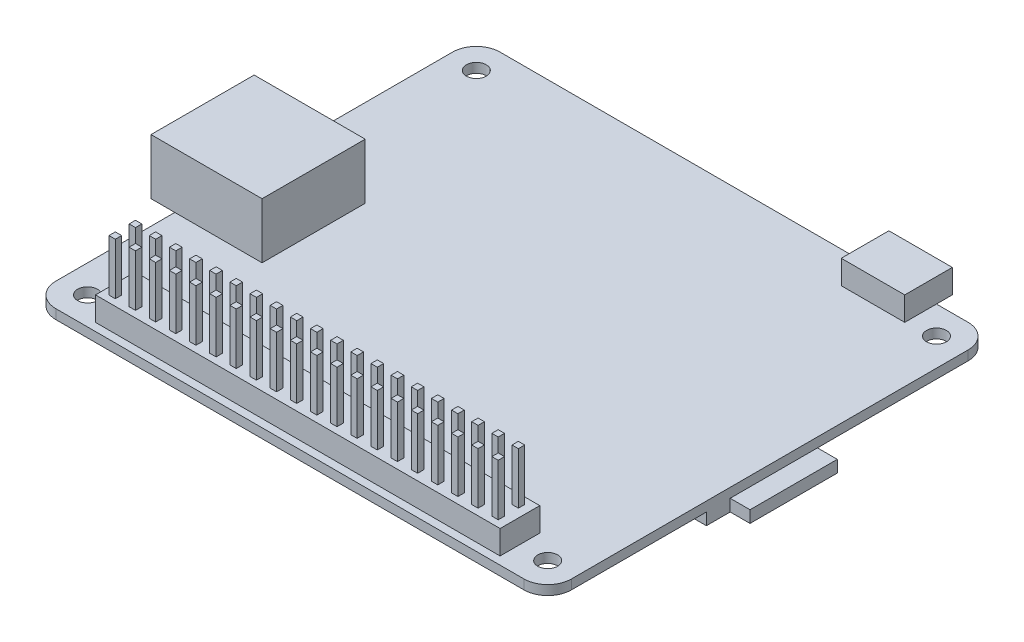
from build123d import *

# Parameters (mm, degrees)
SKETCH1_W             = 65
SKETCH1_H             = 56
BOSS_EXTRUDE1_DEPTH   = 1.2
FILLET1_R             = 3
SKETCH2_R             = 1.25
CUT_EXTRUDE1_DEPTH    = 43.914915822
SKETCH3_W             = 14
SKETCH3_H             = 13
BOSS_EXTRUDE2_DEPTH   = 7
SKETCH4_W             = 51
SKETCH4_H             = 5
BOSS_EXTRUDE3_DEPTH   = 3
SKETCH5_W             = 0.8
SKETCH5_H             = 0.8
BOSS_EXTRUDE4_DEPTH   = 6.5
LPATTERN1_START       = 25.37
LPATTERN1_OUTLINE_W   = 0.8
LPATTERN1_OUTLINE_H   = 6.5
LPATTERN1_DEPTH       = 0.8
LPATTERN1_START_2     = 22.83
LPATTERN1_2_OUTLINE_W = 0.8
LPATTERN1_2_OUTLINE_H = 6.5
LPATTERN1_2_DEPTH     = 0.8
SKETCH7_W             = 18
SKETCH7_H             = 14
BOSS_EXTRUDE5_DEPTH   = 1.5
SKETCH8_W             = 10.030168032
SKETCH8_H             = 8.209032263
CUT_EXTRUDE2_DEPTH    = 1.5
SKETCH9_W             = 8
SKETCH9_H             = 6
BOSS_EXTRUDE6_DEPTH   = 3


# Read off the part's stored shape, not the designer's step: LPattern1
with BuildPart() as part:
    # Sketch1 → Boss-Extrude1 (new body)
    with BuildSketch(Plane(origin=(0, 0, 0), x_dir=(1, 0, 0), z_dir=(0, 1, 0))):
        Rectangle(SKETCH1_W, SKETCH1_H)
    extrude(amount=BOSS_EXTRUDE1_DEPTH)

    # Fillet1
    fillet1_edges = [part.edges().sort_by_distance(p)[0] for p in [
        (32.5, 0.6, 28),
        (-32.5, 0.6, 28),
        (-32.5, 0.6, -28),
        (32.5, 0.6, -28),
    ]]
    fillet(fillet1_edges, radius=FILLET1_R)

    # Sketch2 → Cut-Extrude1 (cut, through all)
    with BuildSketch(Plane(origin=(0, 1.2, 0), x_dir=(1, 0, 0), z_dir=(0, 1, 0))):
        with Locations(Location((-29, 24.5, 0), (0, 0, 270))):
            Circle(SKETCH2_R)
        with Locations(Location((29, 24.5, 0), (0, 0, 270))):
            Circle(SKETCH2_R)
        with Locations(Location((29, -24.5, 0), (0, 0, 270))):
            Circle(SKETCH2_R)
        with Locations(Location((-29, -24.5, 0), (0, 0, 270))):
            Circle(SKETCH2_R)
    extrude(amount=-CUT_EXTRUDE1_DEPTH, mode=Mode.SUBTRACT)

    # Sketch3 → Boss-Extrude2 (add)
    with BuildSketch(Plane(origin=(0, 1.2, 0), x_dir=(1, 0, 0), z_dir=(0, 1, 0))):
        with Locations((-28.5, -3.5)):
            Rectangle(SKETCH3_W, SKETCH3_H)
    extrude(amount=BOSS_EXTRUDE2_DEPTH)

    # Sketch4 → Boss-Extrude3 (add)
    with BuildSketch(Plane(origin=(0, 1.2, 0), x_dir=(1, 0, 0), z_dir=(0, 1, 0))):
        with Locations((0, -24.5)):
            Rectangle(SKETCH4_W, SKETCH4_H)
    extrude(amount=BOSS_EXTRUDE3_DEPTH)

    # Sketch5 → Boss-Extrude4 (add)
    with BuildSketch(Plane(origin=(0, 4.2, 0), x_dir=(1, 0, 0), z_dir=(0, 1, 0))):
        with Locations((-24.227, -23.23)):
            Rectangle(SKETCH5_W, SKETCH5_H)
    extrude(amount=BOSS_EXTRUDE4_DEPTH)

    # LPattern1 outline → LPattern1 (add)
    with BuildSketch(Plane.XY.offset(LPATTERN1_START)):
        with Locations((24.033, 7.45)):
            Rectangle(LPATTERN1_OUTLINE_W, LPATTERN1_OUTLINE_H)
        with Locations((21.493, 7.45)):
            Rectangle(LPATTERN1_OUTLINE_W, LPATTERN1_OUTLINE_H)
        with Locations((18.953, 7.45)):
            Rectangle(LPATTERN1_OUTLINE_W, LPATTERN1_OUTLINE_H)
        with Locations((16.413, 7.45)):
            Rectangle(LPATTERN1_OUTLINE_W, LPATTERN1_OUTLINE_H)
        with Locations((13.873, 7.45)):
            Rectangle(LPATTERN1_OUTLINE_W, LPATTERN1_OUTLINE_H)
        with Locations((11.333, 7.45)):
            Rectangle(LPATTERN1_OUTLINE_W, LPATTERN1_OUTLINE_H)
        with Locations((8.793, 7.45)):
            Rectangle(LPATTERN1_OUTLINE_W, LPATTERN1_OUTLINE_H)
        with Locations((6.253, 7.45)):
            Rectangle(LPATTERN1_OUTLINE_W, LPATTERN1_OUTLINE_H)
        with Locations((3.713, 7.45)):
            Rectangle(LPATTERN1_OUTLINE_W, LPATTERN1_OUTLINE_H)
        with Locations((1.173, 7.45)):
            Rectangle(LPATTERN1_OUTLINE_W, LPATTERN1_OUTLINE_H)
        with Locations((-1.367, 7.45)):
            Rectangle(LPATTERN1_OUTLINE_W, LPATTERN1_OUTLINE_H)
        with Locations((-3.907, 7.45)):
            Rectangle(LPATTERN1_OUTLINE_W, LPATTERN1_OUTLINE_H)
        with Locations((-6.447, 7.45)):
            Rectangle(LPATTERN1_OUTLINE_W, LPATTERN1_OUTLINE_H)
        with Locations((-8.987, 7.45)):
            Rectangle(LPATTERN1_OUTLINE_W, LPATTERN1_OUTLINE_H)
        with Locations((-11.527, 7.45)):
            Rectangle(LPATTERN1_OUTLINE_W, LPATTERN1_OUTLINE_H)
        with Locations((-14.067, 7.45)):
            Rectangle(LPATTERN1_OUTLINE_W, LPATTERN1_OUTLINE_H)
        with Locations((-16.607, 7.45)):
            Rectangle(LPATTERN1_OUTLINE_W, LPATTERN1_OUTLINE_H)
        with Locations((-19.147, 7.45)):
            Rectangle(LPATTERN1_OUTLINE_W, LPATTERN1_OUTLINE_H)
        with Locations((-21.687, 7.45)):
            Rectangle(LPATTERN1_OUTLINE_W, LPATTERN1_OUTLINE_H)
        with Locations((-24.227, 7.45)):
            Rectangle(LPATTERN1_OUTLINE_W, LPATTERN1_OUTLINE_H)
    extrude(amount=LPATTERN1_DEPTH)

    # LPattern1 2 outline → LPattern1 2 (add)
    with BuildSketch(Plane.XY.offset(LPATTERN1_START_2)):
        with Locations((24.033, 7.45)):
            Rectangle(LPATTERN1_2_OUTLINE_W, LPATTERN1_2_OUTLINE_H)
        with Locations((21.493, 7.45)):
            Rectangle(LPATTERN1_2_OUTLINE_W, LPATTERN1_2_OUTLINE_H)
        with Locations((18.953, 7.45)):
            Rectangle(LPATTERN1_2_OUTLINE_W, LPATTERN1_2_OUTLINE_H)
        with Locations((16.413, 7.45)):
            Rectangle(LPATTERN1_2_OUTLINE_W, LPATTERN1_2_OUTLINE_H)
        with Locations((13.873, 7.45)):
            Rectangle(LPATTERN1_2_OUTLINE_W, LPATTERN1_2_OUTLINE_H)
        with Locations((11.333, 7.45)):
            Rectangle(LPATTERN1_2_OUTLINE_W, LPATTERN1_2_OUTLINE_H)
        with Locations((8.793, 7.45)):
            Rectangle(LPATTERN1_2_OUTLINE_W, LPATTERN1_2_OUTLINE_H)
        with Locations((6.253, 7.45)):
            Rectangle(LPATTERN1_2_OUTLINE_W, LPATTERN1_2_OUTLINE_H)
        with Locations((3.713, 7.45)):
            Rectangle(LPATTERN1_2_OUTLINE_W, LPATTERN1_2_OUTLINE_H)
        with Locations((1.173, 7.45)):
            Rectangle(LPATTERN1_2_OUTLINE_W, LPATTERN1_2_OUTLINE_H)
        with Locations((-1.367, 7.45)):
            Rectangle(LPATTERN1_2_OUTLINE_W, LPATTERN1_2_OUTLINE_H)
        with Locations((-3.907, 7.45)):
            Rectangle(LPATTERN1_2_OUTLINE_W, LPATTERN1_2_OUTLINE_H)
        with Locations((-6.447, 7.45)):
            Rectangle(LPATTERN1_2_OUTLINE_W, LPATTERN1_2_OUTLINE_H)
        with Locations((-8.987, 7.45)):
            Rectangle(LPATTERN1_2_OUTLINE_W, LPATTERN1_2_OUTLINE_H)
        with Locations((-11.527, 7.45)):
            Rectangle(LPATTERN1_2_OUTLINE_W, LPATTERN1_2_OUTLINE_H)
        with Locations((-14.067, 7.45)):
            Rectangle(LPATTERN1_2_OUTLINE_W, LPATTERN1_2_OUTLINE_H)
        with Locations((-16.607, 7.45)):
            Rectangle(LPATTERN1_2_OUTLINE_W, LPATTERN1_2_OUTLINE_H)
        with Locations((-19.147, 7.45)):
            Rectangle(LPATTERN1_2_OUTLINE_W, LPATTERN1_2_OUTLINE_H)
        with Locations((-21.687, 7.45)):
            Rectangle(LPATTERN1_2_OUTLINE_W, LPATTERN1_2_OUTLINE_H)
    extrude(amount=LPATTERN1_2_DEPTH)

    # Sketch7 → Boss-Extrude5 (add)
    with BuildSketch(Plane.XZ):
        with Locations((26, 1)):
            Rectangle(SKETCH7_W, SKETCH7_H)
    extrude(amount=BOSS_EXTRUDE5_DEPTH)

    # Sketch8 → Cut-Extrude2 (cut)
    with BuildSketch(Plane.XZ.offset(1.5)):
        with Locations((37.515084016, 9.104516132)):
            Rectangle(SKETCH8_W, SKETCH8_H)
    extrude(amount=-CUT_EXTRUDE2_DEPTH, mode=Mode.SUBTRACT)

    # Sketch9 → Boss-Extrude6 (add)
    with BuildSketch(Plane(origin=(0, 1.2, 0), x_dir=(1, 0, 0), z_dir=(0, 1, 0))):
        with Locations((21.5, 27)):
            Rectangle(SKETCH9_W, SKETCH9_H)
    extrude(amount=BOSS_EXTRUDE6_DEPTH)


solid = part.part
